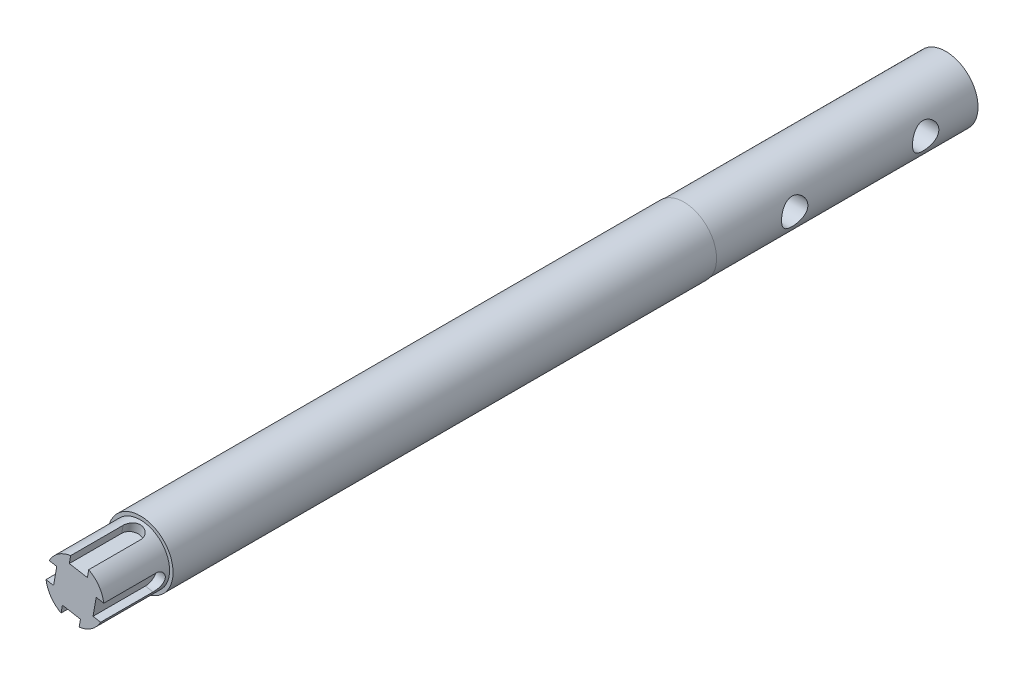
from build123d import *

# Parameters (mm, degrees)
SKETCH1_R               = 24.95
BOSS_EXTRUDE1_DEPTH     = 332.5
CUT_EXTRUDE1_DEPTH      = 335.366946632
CUT_EXTRUDE1_DEPTH_BACK = 335.366946632
SKETCH2_R               = 10.05
CUT_EXTRUDE2_DEPTH      = 337.253855116
SKETCH5_OUTSIDE_W       = 185.646
SKETCH5_OUTSIDE_H       = 185.646
SKETCH5_OUTSIDE_R       = 24.61
CUT_EXTRUDE4_DEPTH      = 200
SKETCH7_OUTSIDE_W       = 185.646
SKETCH7_OUTSIDE_H       = 185.646
SKETCH7_OUTSIDE_R       = 22.3
CUT_EXTRUDE6_DEPTH      = 50
CUT_EXTRUDE7_DEPTH      = 7
CIRPATTERN1_COUNT       = 4


with BuildPart() as part:
    # Sketch1 → Boss-Extrude1 (new, symmetric)
    with BuildSketch(Plane.XY):
        Circle(SKETCH1_R)
    extrude(amount=BOSS_EXTRUDE1_DEPTH, both=True)

    # Sketch2 → Cut-Extrude1 (cut, two sides: drawn at the far end of the back side and taken through both)
    with BuildSketch(Plane(origin=(0, 0, 0), x_dir=(0, 0, -1), z_dir=(1, 0, 0)).offset(-CUT_EXTRUDE1_DEPTH_BACK)):
        with Locations((192.5, 0)):
            Circle(SKETCH2_R)
        with Locations((292.5, 0)):
            Circle(SKETCH2_R)
    extrude(amount=CUT_EXTRUDE1_DEPTH + CUT_EXTRUDE1_DEPTH_BACK, mode=Mode.SUBTRACT)

    # Sketch3 → Cut-Extrude2 (cut, through all)
    with BuildSketch(Plane(origin=(-18.5, 0, 0), x_dir=(0, 0, -1), z_dir=(1, 0, 0))):
        with BuildLine():
            Line((-212.5, -7), (-170.5, -7))
            ThreePointArc((-170.5, -7), (-163.5, 0), (-170.5, 7))
            Line((-170.5, 7), (-212.5, 7))
            ThreePointArc((-212.5, 7), (-219.5, 0), (-212.5, -7))
        make_face()
    extrude(amount=-CUT_EXTRUDE2_DEPTH, mode=Mode.SUBTRACT)

    # Sketch5 outside → Cut-Extrude4 (cut)
    with BuildSketch(Plane(origin=(0, 0, -332.5), x_dir=(-1, 0, 0), z_dir=(0, 0, -1))):
        Rectangle(SKETCH5_OUTSIDE_W, SKETCH5_OUTSIDE_H)
        Circle(SKETCH5_OUTSIDE_R, mode=Mode.SUBTRACT)
    extrude(amount=-CUT_EXTRUDE4_DEPTH, mode=Mode.SUBTRACT)

    # Sketch7 outside → Cut-Extrude6 (cut)
    with BuildSketch(Plane.XY.offset(332.5)):
        Rectangle(SKETCH7_OUTSIDE_W, SKETCH7_OUTSIDE_H)
        Circle(SKETCH7_OUTSIDE_R, mode=Mode.SUBTRACT)
    extrude(amount=-CUT_EXTRUDE6_DEPTH, mode=Mode.SUBTRACT)

    # Sketch8 → Cut-Extrude7 (cut)
    with BuildSketch(Plane(origin=(3.872354362, 21.961212892, 0), x_dir=(0, 0, 1), z_dir=(0.1736481776669241, 0.9848077530122091, 0))):
        with BuildLine():
            Line((292.5, 7), (332.5, 7))
            ThreePointArc((332.5, 7), (339.5, 0), (332.5, -7))
            Line((332.5, -7), (292.5, -7))
            ThreePointArc((292.5, -7), (285.5, 0), (292.5, 7))
        make_face()
    cut_extrude7 = extrude(amount=-CUT_EXTRUDE7_DEPTH, mode=Mode.SUBTRACT)

    # CirPattern1: Cut-Extrude7 ×4 about axis
    cirpattern1_axis = Axis((0, 0, 282.5), (0, 0, 1))
    for i in range(1, CIRPATTERN1_COUNT):
        add(cut_extrude7.rotate(cirpattern1_axis, i * 360 / CIRPATTERN1_COUNT), mode=Mode.SUBTRACT)


solid = part.part
